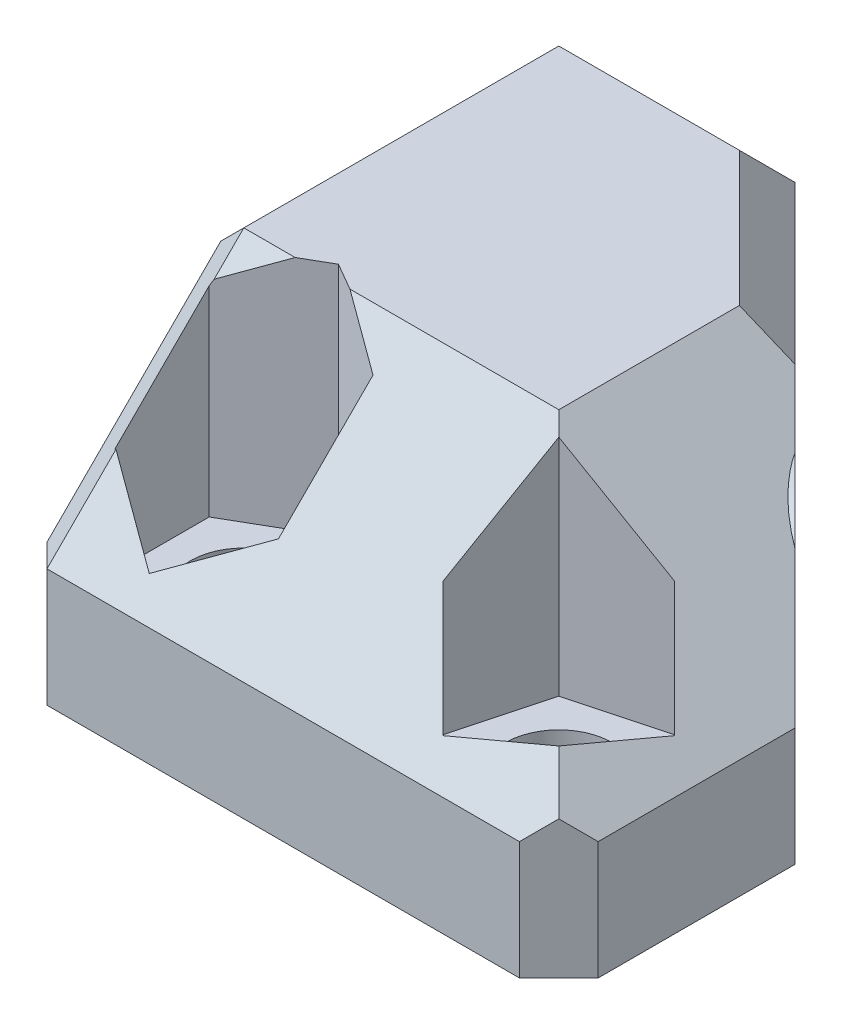
from build123d import *

# Parameters (mm, degrees)
SKETCH1_W               = 12.7
SKETCH1_H               = 12.7
BOSS_EXTRUDE1_DEPTH     = 6.35
SKETCH2_W               = 22.225
SKETCH2_H               = 9.525
BOSS_EXTRUDE2_DEPTH     = 4.7625
CHAMFER1_START          = -6.35
CHAMFER1_DEPTH          = 12.7
CUT_EXTRUDE1_DEPTH      = 7.9375
F_6_CLEARANCE_HOLE1_D   = 4.3053
CHAMFER3_SIZE           = 9.525
F_1_4_CLEARANCE_HOLE1_D = 7.14248
CUT_EXTRUDE2_DEPTH      = 9.525
CUT_EXTRUDE3_DEPTH      = 26.793821935


with BuildPart() as part:
    # Sketch1 → Boss-Extrude1 (new, symmetric)
    with BuildSketch(Plane(origin=(0, 0, 0), x_dir=(1, 0, 0), z_dir=(0, 1, 0))):
        Rectangle(SKETCH1_W, SKETCH1_H)
    extrude(amount=BOSS_EXTRUDE1_DEPTH, both=True)

    # Sketch2 → Boss-Extrude2 (add)
    with BuildSketch(Plane.XZ.offset(6.35)):
        with Locations((4.7625, 11.1125)):
            Rectangle(SKETCH2_W, SKETCH2_H)
    extrude(amount=-BOSS_EXTRUDE2_DEPTH)

    # Chamfer1: read off the stored shape, not the designer's step
    # Chamfer1 outline → Chamfer1 (add)
    with BuildSketch(Plane(origin=(0, 0, 0), x_dir=(1, 0, 0), z_dir=(0, 1, 0)).offset(CHAMFER1_START)):
        Polygon((15.875, -6.35), (6.35, 3.175), (6.35, -6.35), align=None)
    extrude(amount=CHAMFER1_DEPTH)

    # Sketch3 → Cut-Extrude1 (cut)
    with BuildSketch(Plane(origin=(0, 6.35, 0), x_dir=(1, 0, 0), z_dir=(0, 1, 0))):
        Polygon((6.35, 3.175), (6.35, -6.35), (15.875, -6.35), align=None)
    extrude(amount=-CUT_EXTRUDE1_DEPTH, mode=Mode.SUBTRACT)

    # #6 Clearance Hole1 (through all)
    with Locations(Plane(origin=(0, -1.5875, 0), x_dir=(1, 0, 0), z_dir=(0, 1, 0))):
        with Locations((-1.5875, -11.1125), (11.1125, -11.1125)):
            Hole(F_6_CLEARANCE_HOLE1_D / 2)

    # Chamfer3
    # the kernel refuses this chamfer: 9.525 mm, written as the material it adds along each edge
    with BuildSketch(Plane(origin=(6.35, -1.5875, -27.67028046), x_dir=(1, 0, 0), z_dir=(0, 0, 1))) as chamfer3_piece_1_section:
        Polygon((CHAMFER3_SIZE, 0), (0, CHAMFER3_SIZE), (0, 0), align=None)
    chamfer3_piece_1 = extrude(amount=34.02028046, mode=Mode.PRIVATE)
    chamfer3_piece_1 = split(chamfer3_piece_1, bisect_by=Plane(origin=(6.35, 6.35, -27.67028046), z_dir=(0, -1, 0)), keep=Keep.TOP, mode=Mode.PRIVATE)
    chamfer3_piece_1 = split(chamfer3_piece_1, bisect_by=Plane(origin=(-5.89764023, -1.5875, -15.42264023), z_dir=(-0.7071067811865475, 0, 0.7071067811865476)), keep=Keep.TOP, mode=Mode.PRIVATE)
    add(chamfer3_piece_1)
    with BuildSketch(Plane(origin=(-6.35, -1.5875, 6.35), x_dir=(0, 1, 0), z_dir=(1, 0, 0))) as chamfer3_piece_2_section:
        Polygon((CHAMFER3_SIZE, 0), (0, CHAMFER3_SIZE), (0, 0), align=None)
    chamfer3_piece_2 = extrude(amount=12.7, mode=Mode.PRIVATE)
    chamfer3_piece_2 = split(chamfer3_piece_2, bisect_by=Plane(origin=(-6.35, 6.35, 6.35), z_dir=(0, -1, 0)), keep=Keep.TOP, mode=Mode.PRIVATE)
    chamfer3_piece_2 = chamfer3_piece_2 - Plane(origin=(-1.5875, -1.5875, 11.1125), x_dir=(-1, 0, 0), z_dir=(0, -1, 0)) * Cylinder(2.15265, 64, mode=Mode.PRIVATE)
    add(chamfer3_piece_2)
    with BuildSketch(Plane(origin=(-6.35, -1.5875, 6.35), x_dir=(0, 1, 0), z_dir=(1, 0, 0))) as chamfer3_piece_3a_section:
        Polygon((CHAMFER3_SIZE, 0), (0, CHAMFER3_SIZE), (0, 0), align=None)
    chamfer3_piece_3a = extrude(amount=37.19528046, mode=Mode.PRIVATE)
    chamfer3_piece_3a = split(chamfer3_piece_3a, bisect_by=Plane(origin=(-6.35, 6.35, 6.35), z_dir=(0, -1, 0)), keep=Keep.TOP, mode=Mode.PRIVATE)
    chamfer3_piece_3a = split(chamfer3_piece_3a, bisect_by=Plane(origin=(6.35, -1.5875, 6.35), z_dir=(1, 0, 0)), keep=Keep.TOP, mode=Mode.PRIVATE)
    chamfer3_piece_3a = split(chamfer3_piece_3a, bisect_by=Plane(origin=(15.875, -1.5875, 6.35), z_dir=(-1, 0, 0)), keep=Keep.TOP, mode=Mode.PRIVATE)
    chamfer3_piece_3a = chamfer3_piece_3a - Plane(origin=(11.1125, -1.5875, 11.1125), x_dir=(-1, 0, 0), z_dir=(0, -1, 0)) * Cylinder(2.15265, 113, mode=Mode.PRIVATE)
    with BuildSketch(Plane(origin=(6.35, -1.5875, -27.67028046), x_dir=(1, 0, 0), z_dir=(0, 0, 1))) as chamfer3_piece_3b_section:
        Polygon((CHAMFER3_SIZE, 0), (0, CHAMFER3_SIZE), (0, 0), align=None)
    chamfer3_piece_3b = extrude(amount=58.515560921, mode=Mode.PRIVATE)
    chamfer3_piece_3b = split(chamfer3_piece_3b, bisect_by=Plane(origin=(6.35, -1.5875, 6.35), z_dir=(0, 0, 1)), keep=Keep.TOP, mode=Mode.PRIVATE)
    chamfer3_piece_3b = split(chamfer3_piece_3b, bisect_by=Plane(origin=(6.35, 6.35, -27.67028046), z_dir=(0, -1, 0)), keep=Keep.TOP, mode=Mode.PRIVATE)
    chamfer3_piece_3b = split(chamfer3_piece_3b, bisect_by=Plane(origin=(6.35, -1.5875, 15.875), z_dir=(0, 0, -1)), keep=Keep.TOP, mode=Mode.PRIVATE)
    chamfer3_piece_3b = chamfer3_piece_3b - Plane(origin=(11.1125, -1.5875, 11.1125), x_dir=(-1, 0, 0), z_dir=(0, -1, 0)) * Cylinder(2.15265, 156, mode=Mode.PRIVATE)
    chamfer3_piece_3 = chamfer3_piece_3a & chamfer3_piece_3b
    add(chamfer3_piece_3)

    # Sketch9 → Hole1 (revolve, cut)
    with BuildSketch(Plane(origin=(-6.35, 0, 0), x_dir=(0, 0, 1), z_dir=(0, 1, 0))):
        Polygon((0, 0), (0, 7.62), (4.4323, 7.62), (4.6101, 0), align=None)
    revolve(axis=Axis((103.65, 0, 0), (-1, 0, 0)), mode=Mode.SUBTRACT)

    # 1/4 Clearance Hole1 (through all)
    with Locations(Plane.ZY.offset(6.35)):
        with Locations((0, 0)):
            Hole(F_1_4_CLEARANCE_HOLE1_D / 2)

    # Sketch12 → Cut-Extrude2 (cut)
    with BuildSketch(Plane(origin=(0, 6.35, 0), x_dir=(1, 0, 0), z_dir=(0, 1, 0))):
        Polygon((-4.8895, -9.206089411), (-4.8895, -13.018910589), (-1.5875, -14.925321178), (1.7145, -13.018910589), (1.7145, -9.206089411), (-1.5875, -7.299678822), align=None)
        Polygon((8.41642829, -8.41642829), (7.429597553, -12.099330736), (10.125669264, -14.795402447), (13.80857171, -13.80857171), (14.795402447, -10.125669264), (12.099330736, -7.429597553), align=None)
    extrude(amount=-CUT_EXTRUDE2_DEPTH, mode=Mode.SUBTRACT)

    # Sketch15 → Cut-Extrude3 (cut, through all)
    with BuildSketch(Plane(origin=(0, 6.35, 0), x_dir=(1, 0, 0), z_dir=(0, 1, 0))):
        Polygon((6.35, 3.175), (3.175, 6.35), (6.35, 6.35), align=None)
    extrude(amount=-CUT_EXTRUDE3_DEPTH, mode=Mode.SUBTRACT)

    # Chamfer4
    # the kernel refuses this chamfer: 1.5875 mm, written as the material it takes off along each edge
    with BuildSketch(Plane(origin=(-5.291666667, 5.291666667, -5.291666667), x_dir=(0.7071067811865476, 0.7071067811865476, 0), z_dir=(-0.5773502691896257, 0.577350269189626, -0.5773502691896257))) as chamfer4_piece_1:
        Polygon((-1.122532015, -0.648094161), (1.122532015, -0.648094161), (0, 1.296188322), align=None)
    extrude(amount=2.016395815, mode=Mode.SUBTRACT)
    with BuildSketch(Plane(origin=(15.875, -10.432546743, 15.875), x_dir=(0, 0, -1), z_dir=(0, 1, 0))) as chamfer4_piece_2:
        with BuildLine():
            Line((1.632401281, -0.044901281), (-0.044901281, 1.632401281))
            Line((-0.044901281, 1.632401281), (-0.076651281, 1.632401281))
            ThreePointArc((-0.076651281, 1.632401281), (-0.03175, 0.81620064), (-0.03175, 0))
            Line((-0.03175, 0), (0, -0.03175))
            ThreePointArc((0, -0.03175), (0.81620064, -0.03175), (1.632401281, -0.076651281))
            Line((1.632401281, -0.076651281), (1.632401281, -0.044901281))
        make_face()
    extrude(amount=12.927593487, mode=Mode.SUBTRACT)
    with BuildSketch(Plane(origin=(-10.432546743, 6.35, -6.35), x_dir=(0, -1, 0), z_dir=(1, 0, 0))) as chamfer4_piece_3:
        with BuildLine():
            Line((1.632401281, 0.044901281), (-0.044901281, -1.632401281))
            Line((-0.044901281, -1.632401281), (-0.076651281, -1.632401281))
            ThreePointArc((-0.076651281, -1.632401281), (-0.03175, -0.81620064), (-0.03175, 0))
            Line((-0.03175, 0), (0, 0.03175))
            ThreePointArc((0, 0.03175), (0.81620064, 0.03175), (1.632401281, 0.076651281))
            Line((1.632401281, 0.076651281), (1.632401281, 0.044901281))
        make_face()
    extrude(amount=17.690093487, mode=Mode.SUBTRACT)
    with BuildSketch(Plane(origin=(-6.35, -10.432546743, 15.875), x_dir=(0, 0, -1), z_dir=(0, 1, 0))) as chamfer4_piece_4:
        with BuildLine():
            Line((1.632401281, 0.044901281), (-0.044901281, -1.632401281))
            Line((-0.044901281, -1.632401281), (-0.076651281, -1.632401281))
            ThreePointArc((-0.076651281, -1.632401281), (-0.03175, -0.81620064), (-0.03175, 0))
            Line((-0.03175, 0), (0, 0.03175))
            ThreePointArc((0, 0.03175), (0.81620064, 0.03175), (1.632401281, 0.076651281))
            Line((1.632401281, 0.076651281), (1.632401281, 0.044901281))
        make_face()
    extrude(amount=12.927593487, mode=Mode.SUBTRACT)
    with BuildSketch(Plane(origin=(-6.35, 9.236796487, 5.050703513), x_dir=(1, 0, 0), z_dir=(0, -0.7071067811865476, 0.7071067811865476))) as chamfer4_piece_5:
        with BuildLine():
            Line((1.632401281, 0.044901281), (-0.044901281, -1.632401281))
            Line((-0.044901281, -1.632401281), (-0.076651281, -1.632401281))
            ThreePointArc((-0.076651281, -1.632401281), (-0.03175, -0.81620064), (-0.03175, 0))
            Line((-0.03175, 0), (0, 0.03175))
            ThreePointArc((0, 0.03175), (0.81620064, 0.03175), (1.632401281, 0.076651281))
            Line((1.632401281, 0.076651281), (1.632401281, 0.044901281))
        make_face()
    extrude(amount=19.390413638, mode=Mode.SUBTRACT)
    with BuildSketch(Plane(origin=(-6.35, 6.35, 12.020046743), x_dir=(0, -1, 0), z_dir=(0, 0, -1))) as chamfer4_piece_6:
        with BuildLine():
            Line((1.632401281, 0.044901281), (-0.044901281, -1.632401281))
            Line((-0.044901281, -1.632401281), (-0.076651281, -1.632401281))
            ThreePointArc((-0.076651281, -1.632401281), (-0.03175, -0.81620064), (-0.03175, 0))
            Line((-0.03175, 0), (0, 0.03175))
            ThreePointArc((0, 0.03175), (0.81620064, 0.03175), (1.632401281, 0.076651281))
            Line((1.632401281, 0.076651281), (1.632401281, 0.044901281))
        make_face()
    extrude(amount=22.452593487, mode=Mode.SUBTRACT)
    with BuildSketch(Plane(origin=(-6.35, 10.432546743, -6.35), x_dir=(0, 0, 1), z_dir=(0, -1, 0))) as chamfer4_piece_7:
        with BuildLine():
            Line((1.632401281, 0.044901281), (-0.044901281, -1.632401281))
            Line((-0.044901281, -1.632401281), (-0.076651281, -1.632401281))
            ThreePointArc((-0.076651281, -1.632401281), (-0.03175, -0.81620064), (-0.03175, 0))
            Line((-0.03175, 0), (0, 0.03175))
            ThreePointArc((0, 0.03175), (0.81620064, 0.03175), (1.632401281, 0.076651281))
            Line((1.632401281, 0.076651281), (1.632401281, 0.044901281))
        make_face()
    extrude(amount=20.865093487, mode=Mode.SUBTRACT)
    with BuildSketch(Plane(origin=(10.824296487, 6.35, 1.299296487), x_dir=(0, -1, 0), z_dir=(-0.7071067811865507, 0, -0.7071067811865444))) as chamfer4_piece_8:
        with BuildLine():
            Line((1.632401281, -0.044901281), (-0.044901281, 1.632401281))
            Line((-0.044901281, 1.632401281), (-0.076651281, 1.632401281))
            ThreePointArc((-0.076651281, 1.632401281), (-0.03175, 0.81620064), (-0.03175, 0))
            Line((-0.03175, 0), (0, -0.03175))
            ThreePointArc((0, -0.03175), (0.81620064, -0.03175), (1.632401281, -0.076651281))
            Line((1.632401281, -0.076651281), (1.632401281, -0.044901281))
        make_face()
    extrude(amount=14.900285578, mode=Mode.SUBTRACT)


solid = part.part
